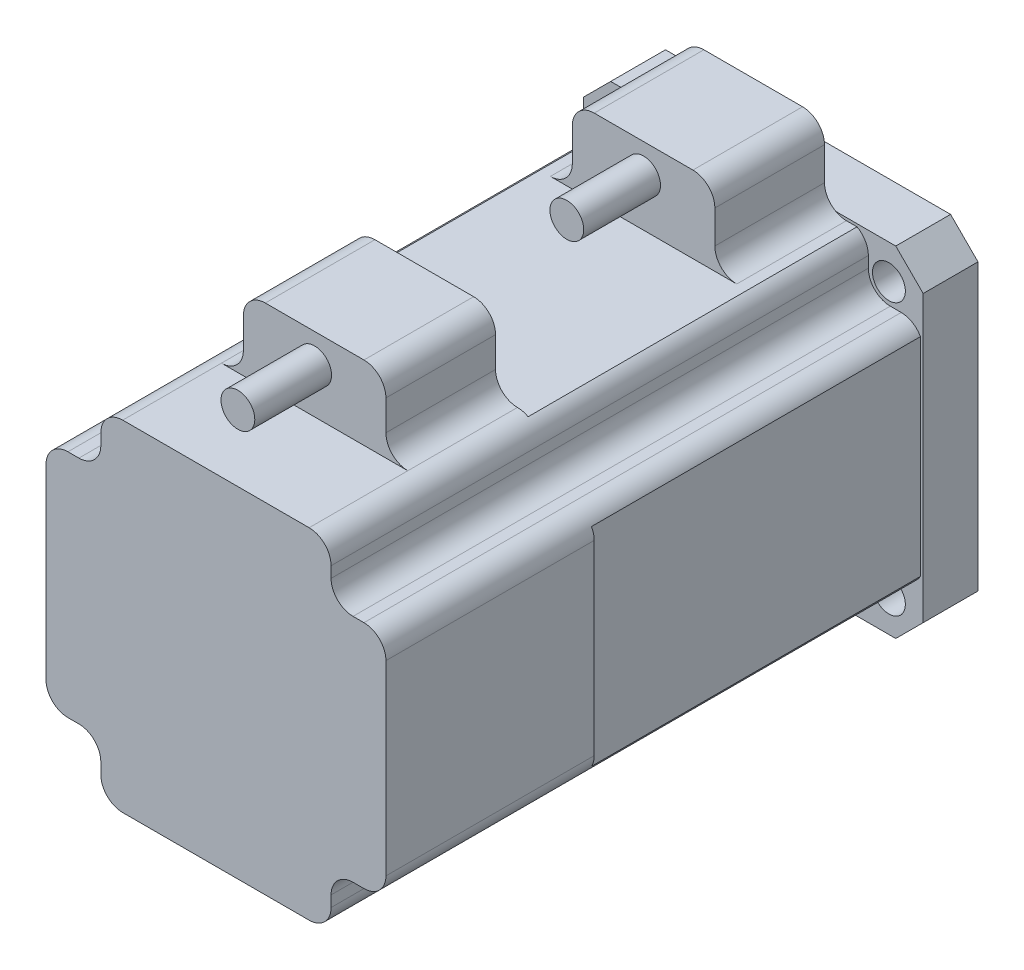
from build123d import *

# Parameters (mm, degrees)
SKETCH_1_W               = 62
SKETCH_1_H               = 62
EXTRUDE_1_DEPTH          = 10
SKETCH_2_W               = 61
SKETCH_2_H               = 61
EXTRUDE_2_DEPTH          = 60
SKETCH_3_W               = 62
SKETCH_3_H               = 62
EXTRUDE_3_DEPTH          = 38
CUT_EXTRUDE_START        = -98
SKETCH_4_W               = 14.732123786
SKETCH_4_H               = 13.996978426
CUT_EXTRUDE_1_DEPTH      = 98
FILLET_1_R               = 4
FILLET_3_R               = 4
SKETCH_5_R               = 4
EXTRUDE_4_DEPTH          = 20
PATTERN_CIRCULAR_4_COUNT = 4
FILLET_4_R               = 4
FILLET_5_R               = 4
CHAMFER_1_SIZE           = 5
SKETCH_6_R               = 25
EXTRUDE_5_DEPTH          = 3
SKETCH_7_R               = 3
CUT_EXTRUDE_2_DEPTH      = 12
PATTERN_CIRCULAR_5_COUNT = 4
CHAMFER_2_SIZE           = 0.5
SKETCH_8_W               = 26
SKETCH_8_H               = 20
EXTRUDE_6_DEPTH          = 14
SKETCH_9_R               = 3.083920488
EXTRUDE_7_DEPTH          = 14
FILLET_START             = 9
FILLET_6_DEPTH           = 21
FILLET_START_2           = 10
FILLET_6_2_DEPTH         = 20
PATTERN_LINEAR_2_COUNT   = 2
PATTERN_LINEAR_2_PITCH   = 60
FILLET_7_R               = 4


with BuildPart() as part:
    # 草图1 → 凸台-拉伸1 (new body)
    with BuildSketch(Plane.XY):
        Rectangle(SKETCH_1_W, SKETCH_1_H)
    extrude(amount=EXTRUDE_1_DEPTH)

    # 草图2 → 凸台-拉伸2 (add)
    with BuildSketch(Plane.XY.offset(10)):
        Rectangle(SKETCH_2_W, SKETCH_2_H)
    extrude(amount=EXTRUDE_2_DEPTH)

    # 草图3 → 凸台-拉伸3 (add)
    with BuildSketch(Plane.XY.offset(70)):
        Rectangle(SKETCH_3_W, SKETCH_3_H)
    extrude(amount=EXTRUDE_3_DEPTH)

    # 草图4 → 切除-拉伸1 (cut)
    with BuildSketch(Plane.XY.offset(108).offset(CUT_EXTRUDE_START)):
        with Locations((-28.366061893, 27.998489213)):
            Rectangle(SKETCH_4_W, SKETCH_4_H)
    cut_extrude_1 = extrude(amount=CUT_EXTRUDE_1_DEPTH, mode=Mode.SUBTRACT)

    # 圆角1
    fillet_1_edges = [part.edges().sort_by_distance(p)[0] for p in [
        (-21, 21, 59),
    ]]
    fillet(fillet_1_edges, radius=FILLET_1_R)

    # 圆角3
    fillet_3_edges = [part.edges().sort_by_distance(p)[0] for p in [
        (-31, 21, 89),
        (-21, 31, 89),
    ]]
    fillet(fillet_3_edges, radius=FILLET_3_R)

    # 草图5 → 凸台-拉伸4 (add)
    with BuildSketch(Plane(origin=(0, 0, 0), x_dir=(-1, 0, 0), z_dir=(0, 0, -1))):
        Circle(SKETCH_5_R)
    extrude(amount=EXTRUDE_4_DEPTH)

    # 阵列(圆周)4: 切除-拉伸1 ×4 about axis
    pattern_circular_4_axis = Axis((0, 0, 0), (0, 0, 1))
    for i in range(1, PATTERN_CIRCULAR_4_COUNT):
        add(cut_extrude_1.rotate(pattern_circular_4_axis, i * 360 / PATTERN_CIRCULAR_4_COUNT), mode=Mode.SUBTRACT)

    # 圆角4
    fillet_4_edges = [part.edges().sort_by_distance(p)[0] for p in [
        (-21, -21, 59),
        (21, -21, 59),
        (21, 21, 59),
    ]]
    fillet(fillet_4_edges, radius=FILLET_4_R)

    # 圆角5
    fillet_5_edges = [part.edges().sort_by_distance(p)[0] for p in [
        (-31, -21, 89),
        (-21, -31, 89),
        (21, -31, 89),
        (31, -21, 89),
        (31, 21, 89),
        (21, 31, 89),
    ]]
    fillet(fillet_5_edges, radius=FILLET_5_R)

    # 倒角1
    chamfer_1_edges = [part.edges().sort_by_distance(p)[0] for p in [
        (31, -31, 5),
        (-31, -31, 5),
        (-31, 31, 5),
        (31, 31, 5),
    ]]
    chamfer(chamfer_1_edges, length=CHAMFER_1_SIZE)

    # 草图6 → 凸台-拉伸5 (add)
    with BuildSketch(Plane(origin=(0, 0, 0), x_dir=(-1, 0, 0), z_dir=(0, 0, -1))):
        Circle(SKETCH_6_R)
    extrude(amount=EXTRUDE_5_DEPTH)

    # 草图7 → 切除-拉伸2 (cut)
    with BuildSketch(Plane(origin=(0, 0, 0), x_dir=(-1, 0, 0), z_dir=(0, 0, -1))):
        with Locations((24.748737342, 24.748737342)):
            Circle(SKETCH_7_R)
    cut_extrude_2 = extrude(amount=-CUT_EXTRUDE_2_DEPTH, mode=Mode.SUBTRACT)

    # 阵列(圆周)5: 切除-拉伸2 ×4 about axis
    pattern_circular_5_axis = Axis((0, 0, 0), (0, 0, 1))
    for i in range(1, PATTERN_CIRCULAR_5_COUNT):
        add(cut_extrude_2.rotate(pattern_circular_5_axis, i * 360 / PATTERN_CIRCULAR_5_COUNT), mode=Mode.SUBTRACT)

    # 倒角2
    chamfer_2_edges = [part.edges().sort_by_distance(p)[0] for p in [
        (25, 0, -3),
        (4, 0, -20),
    ]]
    chamfer(chamfer_2_edges, length=CHAMFER_2_SIZE)

    # 草图8 → 凸台-拉伸6 (add)
    with BuildSketch(Plane(origin=(0, 30.5, 0), x_dir=(1, 0, 0), z_dir=(0, 1, 0))):
        with Locations((0, -20)):
            Rectangle(SKETCH_8_W, SKETCH_8_H)
    extrude_6 = extrude(amount=EXTRUDE_6_DEPTH)

    # 草图9 → 凸台-拉伸7 (add)
    with BuildSketch(Plane.XY.offset(30)):
        with Locations(Location((0, 39.131165124, 0), (0, 0, 180))):
            Circle(SKETCH_9_R)
    extrude_7 = extrude(amount=EXTRUDE_7_DEPTH)

    # 圆角6: read off the stored shape, not the designer's step
    # 圆角6 outline → 圆角6 (cut)
    with BuildSketch(Plane.XY.offset(FILLET_START)):
        with BuildLine():
            ThreePointArc((9, 44.5), (11.828427125, 43.328427125), (13, 40.5))
            Line((13, 40.5), (13, 44.5))
            Line((13, 44.5), (9, 44.5))
        make_face()
        with BuildLine():
            ThreePointArc((-13, 40.5), (-11.828427125, 43.328427125), (-9, 44.5))
            Line((-9, 44.5), (-13, 44.5))
            Line((-13, 44.5), (-13, 40.5))
        make_face()
    extrude(amount=FILLET_6_DEPTH, mode=Mode.SUBTRACT)

    # Fillet 6 2 outline → Fillet 6 2 (add)
    with BuildSketch(Plane.XY.offset(FILLET_START_2)):
        with BuildLine():
            ThreePointArc((17, 30.5), (14.171572875, 31.671572875), (13, 34.5))
            Line((13, 34.5), (13, 30.5))
            Line((13, 30.5), (17, 30.5))
        make_face()
        with BuildLine():
            Line((-17, 30.5), (-13, 30.5))
            Line((-13, 30.5), (-13, 34.5))
            ThreePointArc((-13, 34.5), (-14.171572875, 31.671572875), (-17, 30.5))
        make_face()
    extrude(amount=FILLET_6_2_DEPTH)

    # 阵列(线性)2: 凸台-拉伸6, 凸台-拉伸7 ×2
    with Locations(*[(0, 0, i * PATTERN_LINEAR_2_PITCH) for i in range(1, PATTERN_LINEAR_2_COUNT)]):
        add(extrude_6)
        add(extrude_7)

    # 圆角7
    fillet_7_edges = [part.edges().sort_by_distance(p)[0] for p in [
        (13, 31, 80),
        (-13, 31, 80),
    ]]
    fillet(fillet_7_edges, radius=FILLET_7_R - 0.0001)  # a hair under: the kernel refuses the full size
    fillet_7_2_edges = [part.edges().sort_by_distance(p)[0] for p in [
        (13, 44.5, 80),
        (-13, 44.5, 80),
    ]]
    fillet(fillet_7_2_edges, radius=FILLET_7_R)


solid = part.part
